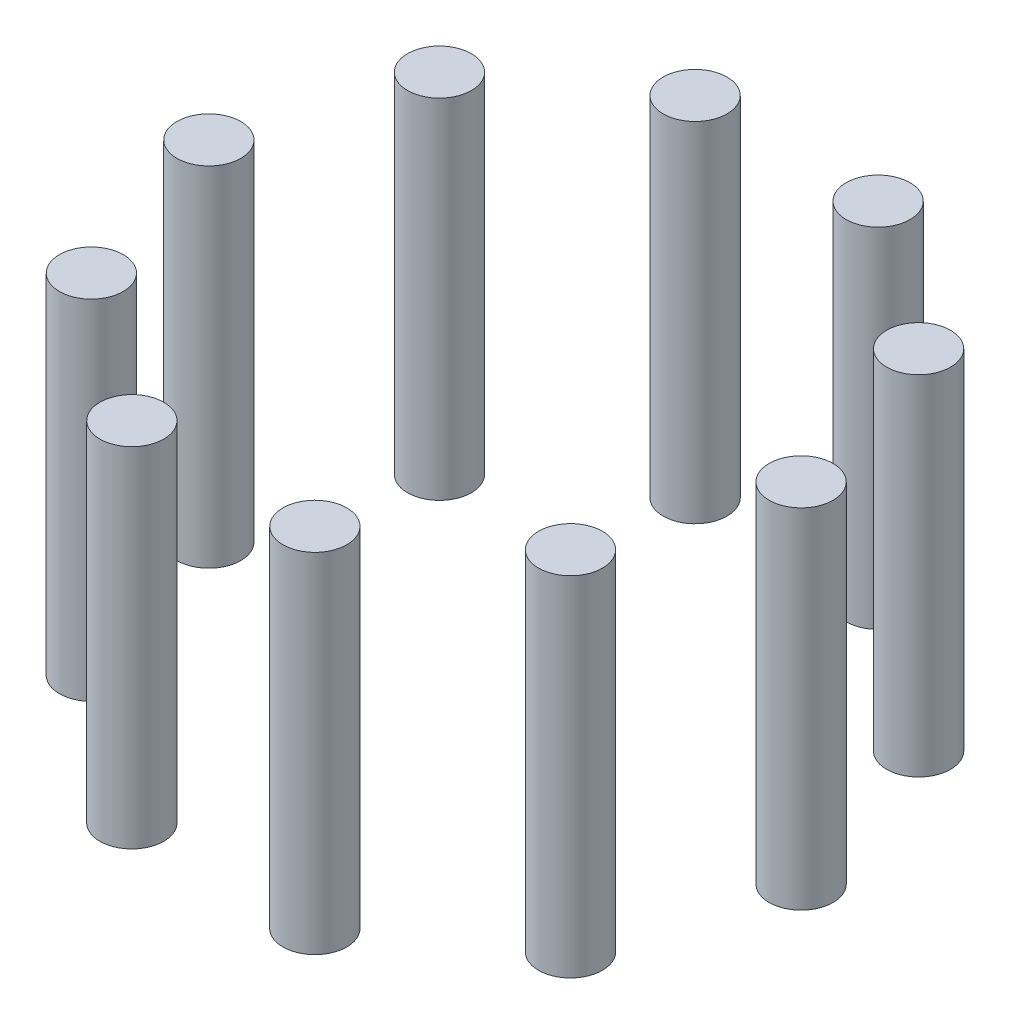
from build123d import *

# Parameters (mm, degrees)
SKETCH1_R              = 5.5
BOSS_EXTRUDE1_DEPTH    = 60
BOSS_EXTRUDE1_2_DEPTH  = 60
BOSS_EXTRUDE1_3_DEPTH  = 60
BOSS_EXTRUDE1_4_DEPTH  = 60
BOSS_EXTRUDE1_5_DEPTH  = 60
BOSS_EXTRUDE1_6_DEPTH  = 60
BOSS_EXTRUDE1_7_DEPTH  = 60
BOSS_EXTRUDE1_8_DEPTH  = 60
BOSS_EXTRUDE1_9_DEPTH  = 60
BOSS_EXTRUDE1_10_DEPTH = 60


with BuildPart() as part:
    # Sketch1 → Boss-Extrude1 (new body)
    with BuildSketch(Plane(origin=(0, 0, 0), x_dir=(1, 0, 0), z_dir=(0, 1, 0))):
        with Locations((51, 0)):
            Circle(SKETCH1_R)
    extrude(amount=BOSS_EXTRUDE1_DEPTH)


with BuildPart() as body_2:
    # Sketch1 → Boss-Extrude1 2 (new body)
    with BuildSketch(Plane(origin=(0, 0, 0), x_dir=(1, 0, 0), z_dir=(0, 1, 0))):
        with Locations((41.259866713, -29.977047867)):
            Circle(SKETCH1_R)
    extrude(amount=BOSS_EXTRUDE1_2_DEPTH)


with BuildPart() as body_3:
    # Sketch1 → Boss-Extrude1 3 (new body)
    with BuildSketch(Plane(origin=(0, 0, 0), x_dir=(1, 0, 0), z_dir=(0, 1, 0))):
        with Locations((15.759866713, -48.503882331)):
            Circle(SKETCH1_R)
    extrude(amount=BOSS_EXTRUDE1_3_DEPTH)


with BuildPart() as body_4:
    # Sketch1 → Boss-Extrude1 4 (new body)
    with BuildSketch(Plane(origin=(0, 0, 0), x_dir=(1, 0, 0), z_dir=(0, 1, 0))):
        with Locations((-15.759866713, -48.503882331)):
            Circle(SKETCH1_R)
    extrude(amount=BOSS_EXTRUDE1_4_DEPTH)


with BuildPart() as body_5:
    # Sketch1 → Boss-Extrude1 5 (new body)
    with BuildSketch(Plane(origin=(0, 0, 0), x_dir=(1, 0, 0), z_dir=(0, 1, 0))):
        with Locations((-41.259866713, -29.977047867)):
            Circle(SKETCH1_R)
    extrude(amount=BOSS_EXTRUDE1_5_DEPTH)


with BuildPart() as body_6:
    # Sketch1 → Boss-Extrude1 6 (new body)
    with BuildSketch(Plane(origin=(0, 0, 0), x_dir=(1, 0, 0), z_dir=(0, 1, 0))):
        with Locations((-51, 0)):
            Circle(SKETCH1_R)
    extrude(amount=BOSS_EXTRUDE1_6_DEPTH)


with BuildPart() as body_7:
    # Sketch1 → Boss-Extrude1 7 (new body)
    with BuildSketch(Plane(origin=(0, 0, 0), x_dir=(1, 0, 0), z_dir=(0, 1, 0))):
        with Locations((-41.259866713, 29.977047867)):
            Circle(SKETCH1_R)
    extrude(amount=BOSS_EXTRUDE1_7_DEPTH)


with BuildPart() as body_8:
    # Sketch1 → Boss-Extrude1 8 (new body)
    with BuildSketch(Plane(origin=(0, 0, 0), x_dir=(1, 0, 0), z_dir=(0, 1, 0))):
        with Locations((-15.759866713, 48.503882331)):
            Circle(SKETCH1_R)
    extrude(amount=BOSS_EXTRUDE1_8_DEPTH)


with BuildPart() as body_9:
    # Sketch1 → Boss-Extrude1 9 (new body)
    with BuildSketch(Plane(origin=(0, 0, 0), x_dir=(1, 0, 0), z_dir=(0, 1, 0))):
        with Locations((15.759866713, 48.503882331)):
            Circle(SKETCH1_R)
    extrude(amount=BOSS_EXTRUDE1_9_DEPTH)


with BuildPart() as body_10:
    # Sketch1 → Boss-Extrude1 10 (new body)
    with BuildSketch(Plane(origin=(0, 0, 0), x_dir=(1, 0, 0), z_dir=(0, 1, 0))):
        with Locations((41.259866713, 29.977047867)):
            Circle(SKETCH1_R)
    extrude(amount=BOSS_EXTRUDE1_10_DEPTH)


solid = Compound([part.part, body_2.part, body_3.part, body_4.part, body_5.part, body_6.part, body_7.part, body_8.part, body_9.part, body_10.part])
